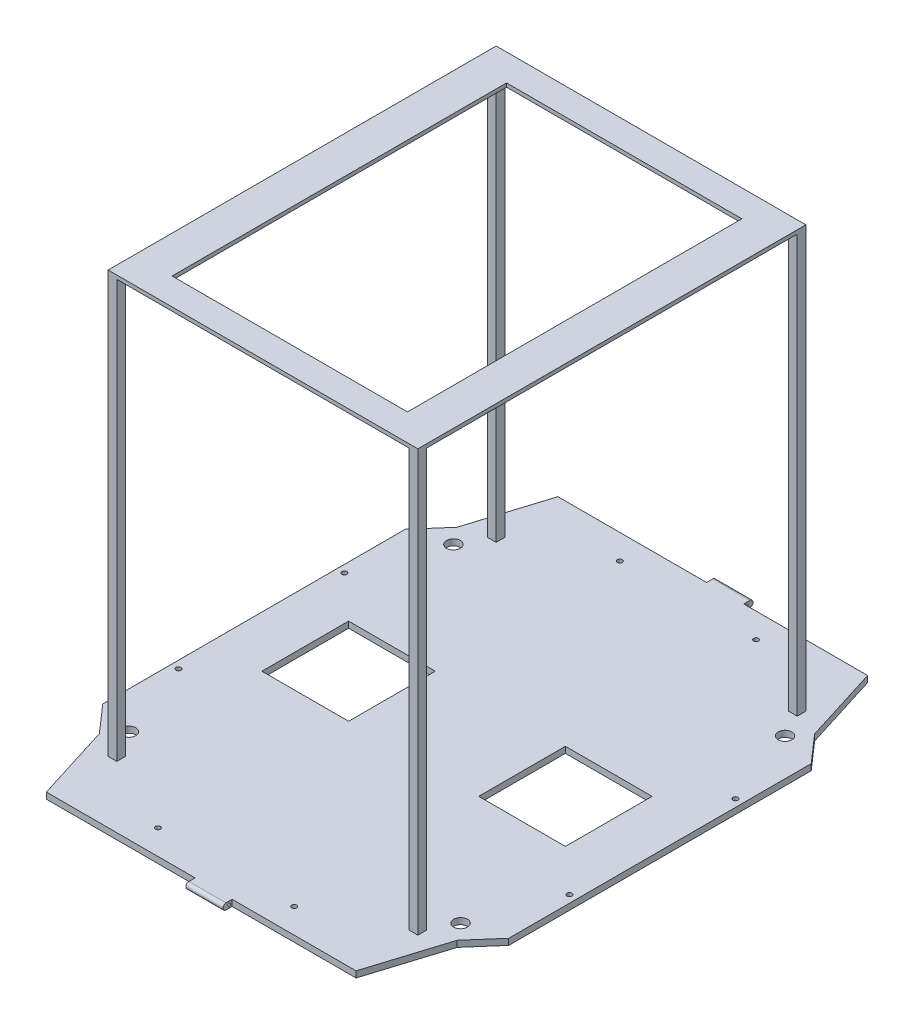
from build123d import *

# Parameters (mm, degrees)
ESQUISSE1_R                  = 5.549450549
ESQUISSE1_W                  = 8
ESQUISSE1_H                  = 94.34065934
ESQUISSE1_W_2                = 70
ESQUISSE1_H_2                = 70
BOSS_EXTRU_1_DEPTH           = 5
ESQUISSE4_R                  = 2
ENL_V_MAT_EXTRU_5_DEPTH      = 350
ESQUISSE9_W                  = 8
ESQUISSE9_H                  = 94.34065934
BOSS_EXTRU_2_DEPTH           = 5
BOSS_EXTRU_4_DEPTH           = 5
ESQUISSE11_W                 = 7
ESQUISSE11_H                 = 7
BOSS_EXTRU_6_DEPTH           = 340
ENL_V_MAT_EXTRU_6_DEPTH      = 10
ENL_V_MAT_EXTRU_6_DEPTH_BACK = 10
ESQUISSE12_R                 = 2
ESQUISSE14_R                 = 1
BOSS_EXTRU_8_DEPTH           = 10
SYM_TRIE1_START              = -10
SYM_TRIE1_OUTLINE_R          = 1
SYM_TRIE1_DEPTH              = 40
ESQUISSE15_W                 = 5
ESQUISSE15_H                 = 10.313810077
ENL_V_MAT_EXTRU_7_DEPTH      = 5
ESQUISSE17_W                 = 250
ESQUISSE17_H                 = 313.215569532
BOSS_EXTRU_9_DEPTH           = 3
ESQUISSE18_W                 = 190
ESQUISSE18_H                 = 270
ENL_V_MAT_EXTRU_8_DEPTH      = 24


# Read off the part's stored shape, not the designer's step: Symétrie1
with BuildPart() as part:
    # Esquisse1 → Boss.-Extru.1 (new body)
    with BuildSketch(Plane(origin=(0, 0, 0), x_dir=(1, 0, 0), z_dir=(0, 1, 0))):
        Polygon((-125, 166.483516484), (125, 166.483516484), (163.846153846, 122.087912088), (163.846153846, -122.087912088), (125, -166.483516484), (-125, -166.483516484), (-163.846153846, -122.087912088), (-163.846153846, 122.087912088), align=None)
        with Locations(Location((-133.846153846, 130.967032967, 0), (0, 0, 270))):
            Circle(ESQUISSE1_R, mode=Mode.SUBTRACT)
        with Locations(Location((-133.846153846, -130.967032967, 0), (0, 0, 90))):
            Circle(ESQUISSE1_R, mode=Mode.SUBTRACT)
        with Locations(Location((133.846153846, -130.967032967, 0), (0, 0, 270))):
            Circle(ESQUISSE1_R, mode=Mode.SUBTRACT)
        with Locations(Location((133.846153846, 130.967032967, 0), (0, 0, 90))):
            Circle(ESQUISSE1_R, mode=Mode.SUBTRACT)
        with Locations((-144, 0)):
            Rectangle(ESQUISSE1_W, ESQUISSE1_H, mode=Mode.SUBTRACT)
        with Locations((87.5, 0)):
            Rectangle(ESQUISSE1_W_2, ESQUISSE1_H_2, mode=Mode.SUBTRACT)
        with Locations((-87.5, 0)):
            Rectangle(ESQUISSE1_W_2, ESQUISSE1_H_2, mode=Mode.SUBTRACT)
        with Locations((144, 0)):
            Rectangle(ESQUISSE1_W, ESQUISSE1_H, mode=Mode.SUBTRACT)
    extrude(amount=BOSS_EXTRU_1_DEPTH)

    # Esquisse4 → Enlèv. mat.-Extru.5 (cut)
    with BuildSketch(Plane(origin=(0, 5, 0), x_dir=(1, 0, 0), z_dir=(0, 1, 0))):
        with Locations(Location((-157.846153846, 67, 0), (0, 0, 270))):
            Circle(ESQUISSE4_R)
        with Locations(Location((157.846153846, 67, 0), (0, 0, 90))):
            Circle(ESQUISSE4_R)
        with Locations(Location((-157.846153846, -67, 0), (0, 0, 90))):
            Circle(ESQUISSE4_R)
        with Locations(Location((157.846153846, -67, 0), (0, 0, 270))):
            Circle(ESQUISSE4_R)
    extrude(amount=-ENL_V_MAT_EXTRU_5_DEPTH, mode=Mode.SUBTRACT)

    # Esquisse9 → Boss.-Extru.2 (add)
    with BuildSketch(Plane(origin=(0, 5, 0), x_dir=(1, 0, 0), z_dir=(0, 1, 0))):
        with Locations((-144, 0)):
            Rectangle(ESQUISSE9_W, ESQUISSE9_H)
        with Locations((144, 0)):
            Rectangle(ESQUISSE9_W, ESQUISSE9_H)
    extrude(amount=-BOSS_EXTRU_2_DEPTH)

    # Esquisse10 → Boss.-Extru.4 (add)
    with BuildSketch(Plane(origin=(0, 5, 0), x_dir=(1, 0, 0), z_dir=(0, 1, 0))):
        Polygon((-125, 206.483516484), (-144.423076923, 144.285714286), (144.423076923, 144.285714286), (125, 206.483516484), align=None)
        Polygon((125, -206.483516484), (144.423076923, -144.285714286), (-144.423076923, -144.285714286), (-125, -206.483516484), align=None)
    extrude(amount=-BOSS_EXTRU_4_DEPTH)

    # Esquisse11 → Boss.-Extru.6 (add)
    with BuildSketch(Plane(origin=(0, 5, 0), x_dir=(1, 0, 0), z_dir=(0, 1, 0))):
        with Locations((121.5, -153.107784766)):
            Rectangle(ESQUISSE11_W, ESQUISSE11_H)
        with Locations((-121.5, -153.107784766)):
            Rectangle(ESQUISSE11_W, ESQUISSE11_H)
        with Locations((121.5, 153.107784766)):
            Rectangle(ESQUISSE11_W, ESQUISSE11_H)
        with Locations((-121.5, 153.107784766)):
            Rectangle(ESQUISSE11_W, ESQUISSE11_H)
    extrude(amount=BOSS_EXTRU_6_DEPTH)

    # Esquisse12 → Enlèv. mat.-Extru.6 (cut, two sides: drawn at the far end of the back side and taken through both)
    with BuildSketch(Plane(origin=(0, 5, 0), x_dir=(1, 0, 0), z_dir=(0, 1, 0)).offset(-ENL_V_MAT_EXTRU_6_DEPTH_BACK)):
        with Locations(Location((-55, 186.483516484, 0), (0, 0, 90))):
            Circle(ESQUISSE12_R)
        with Locations(Location((55, 186.483516484, 0), (0, 0, 90))):
            Circle(ESQUISSE12_R)
        with Locations(Location((55, -186.483516484, 0), (0, 0, 90))):
            Circle(ESQUISSE12_R)
        with Locations(Location((-55, -186.483516484, 0), (0, 0, 90))):
            Circle(ESQUISSE12_R)
    extrude(amount=ENL_V_MAT_EXTRU_6_DEPTH + ENL_V_MAT_EXTRU_6_DEPTH_BACK, mode=Mode.SUBTRACT)

    # Esquisse14 → Boss.-Extru.8 (add, symmetric)
    with BuildSketch(Plane(origin=(0, 0, 0), x_dir=(0, 0, -1), z_dir=(1, 0, 0))):
        with BuildLine():
            Line((206.483516484, 5), (211.463094512, 5))
            ThreePointArc((211.463094512, 5), (213.963094512, 2.5), (211.463094512, 0))
            Line((211.463094512, 0), (206.483516484, 0))
            Line((206.483516484, 0), (206.483516484, 5))
        make_face()
        with Locations((208.973305498, 2.5)):
            Circle(ESQUISSE14_R, mode=Mode.SUBTRACT)
    extrude(amount=BOSS_EXTRU_8_DEPTH, both=True)

    # Symétrie1 outline → Symétrie1 (add)
    # profile 1 of 2: a face of its own
    with BuildSketch(Plane.YZ.offset(SYM_TRIE1_START)):
        with BuildLine():
            Line((0, -206.483516484), (0, -211.463094512))
            ThreePointArc((0, -211.463094512), (2.5, -213.963094512), (5, -211.463094512))
            Line((5, -211.463094512), (5, -206.483516484))
            Line((5, -206.483516484), (0, -206.483516484))
        make_face()
        with Locations((2.5, -208.973305498)):
            Circle(SYM_TRIE1_OUTLINE_R, mode=Mode.SUBTRACT)
    # profile 2 of 2: a face of its own
    with BuildSketch(Plane.YZ.offset(SYM_TRIE1_START)):
        with BuildLine():
            Line((0, 211.463094512), (0, 206.483516484))
            Line((0, 206.483516484), (5, 206.483516484))
            Line((5, 206.483516484), (5, 211.463094512))
            ThreePointArc((5, 211.463094512), (2.5, 213.963094512), (0, 211.463094512))
        make_face()
        with Locations((2.5, 208.973305498)):
            Circle(SYM_TRIE1_OUTLINE_R, mode=Mode.SUBTRACT)
    extrude(amount=SYM_TRIE1_DEPTH)

    # Esquisse15 → Enlèv. mat.-Extru.7 (cut)
    with BuildSketch(Plane(origin=(0, 5, 0), x_dir=(1, 0, 0), z_dir=(0, 1, 0))):
        with Locations((-7.5, 211.640421522)):
            Rectangle(ESQUISSE15_W, ESQUISSE15_H)
        with Locations((27.5, 211.640421522)):
            Rectangle(ESQUISSE15_W, ESQUISSE15_H)
        with Locations((27.5, -211.640421522)):
            Rectangle(ESQUISSE15_W, ESQUISSE15_H)
        with Locations((-7.5, -211.640421522)):
            Rectangle(ESQUISSE15_W, ESQUISSE15_H)
    extrude(amount=-ENL_V_MAT_EXTRU_7_DEPTH, mode=Mode.SUBTRACT)

    # Esquisse17 → Boss.-Extru.9 (add)
    with BuildSketch(Plane(origin=(0, 345, 0), x_dir=(1, 0, 0), z_dir=(0, 1, 0))):
        Rectangle(ESQUISSE17_W, ESQUISSE17_H)
    extrude(amount=-BOSS_EXTRU_9_DEPTH)

    # Esquisse18 → Enlèv. mat.-Extru.8 (cut)
    with BuildSketch(Plane(origin=(0, 345, 0), x_dir=(1, 0, 0), z_dir=(0, 1, 0))):
        Rectangle(ESQUISSE18_W, ESQUISSE18_H)
    extrude(amount=-ENL_V_MAT_EXTRU_8_DEPTH, mode=Mode.SUBTRACT)


solid = part.part
